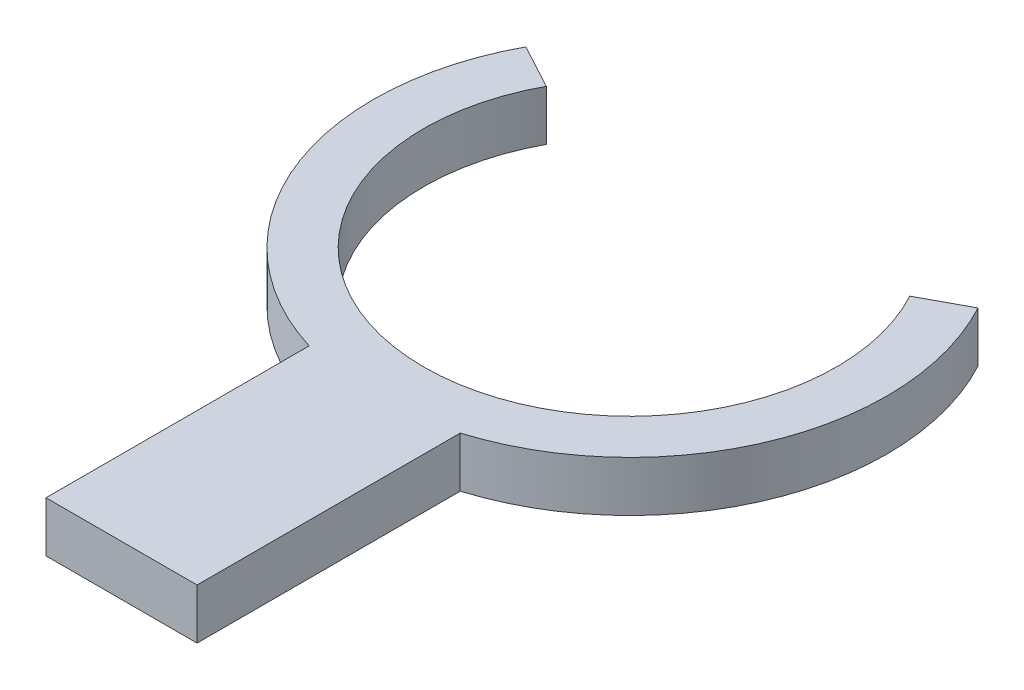
from build123d import *

# Parameters (mm, degrees)
BOSS_EXTRUDE1_DEPTH = 10


with BuildPart() as part:
    # Sketch1 → Boss-Extrude1 (new body)
    with BuildSketch(Plane(origin=(0, 0, 0), x_dir=(1, 0, 0), z_dir=(0, 1, 0))):
        with BuildLine():
            ThreePointArc((-44.897795395, 24.190658706), (-47.187977934, -19.346698388), (-14.99435458, -48.745967328))
            Line((-14.99435458, -48.745967328), (-15, -101))
            Line((-15, -101), (15, -101))
            Line((15, -101), (15.005645795, -48.742492696))
            ThreePointArc((15.005645795, -48.742492696), (47.190218372, -19.341232897), (44.897795395, 24.190658706))
            Line((44.897795395, 24.190658706), (36.094306102, 19.447392293))
            ThreePointArc((36.094306102, 19.447392293), (0, -41), (-36.094306102, 19.447392293))
            Line((-36.094306102, 19.447392293), (-44.897795395, 24.190658706))
        make_face()
    extrude(amount=BOSS_EXTRUDE1_DEPTH)


solid = part.part
